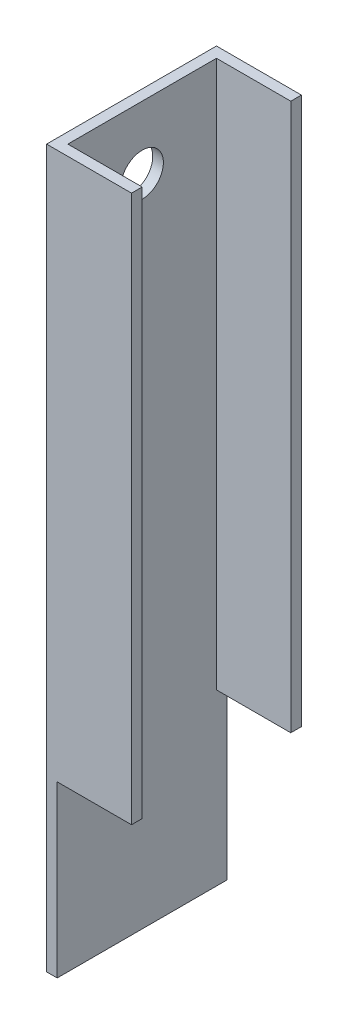
from build123d import *

# Parameters (mm, degrees)
BOSS_EXTRUDE1_DEPTH = 107.188
SKETCH2_W           = 22.225
SKETCH2_H           = 50.8
CUT_EXTRUDE1_DEPTH  = 208.026
SKETCH3_R           = 6.35
CUT_EXTRUDE2_DEPTH  = 45.974


with BuildPart() as part:
    # Sketch1 → Boss-Extrude1 (new, symmetric)
    with BuildSketch(Plane(origin=(0, 0, 0), x_dir=(1, 0, 0), z_dir=(0, 1, 0))):
        Polygon((-20.955, 0), (-20.955, 25.4), (4.445, 25.4), (4.445, 22.225), (-17.78, 22.225), (-17.78, -22.225), (4.445, -22.225), (4.445, -25.4), (-20.955, -25.4), align=None)
    extrude(amount=BOSS_EXTRUDE1_DEPTH, both=True)

    # Sketch2 → Cut-Extrude1 (cut)
    with BuildSketch(Plane.XY.offset(25.4)):
        with Locations((-6.6675, -81.788)):
            Rectangle(SKETCH2_W, SKETCH2_H)
    extrude(amount=-CUT_EXTRUDE1_DEPTH, mode=Mode.SUBTRACT)

    # Sketch3 → Cut-Extrude2 (cut)
    with BuildSketch(Plane.ZY.offset(20.955)):
        with Locations((0, 88.138)):
            Circle(SKETCH3_R)
    extrude(amount=-CUT_EXTRUDE2_DEPTH, mode=Mode.SUBTRACT)


solid = part.part
